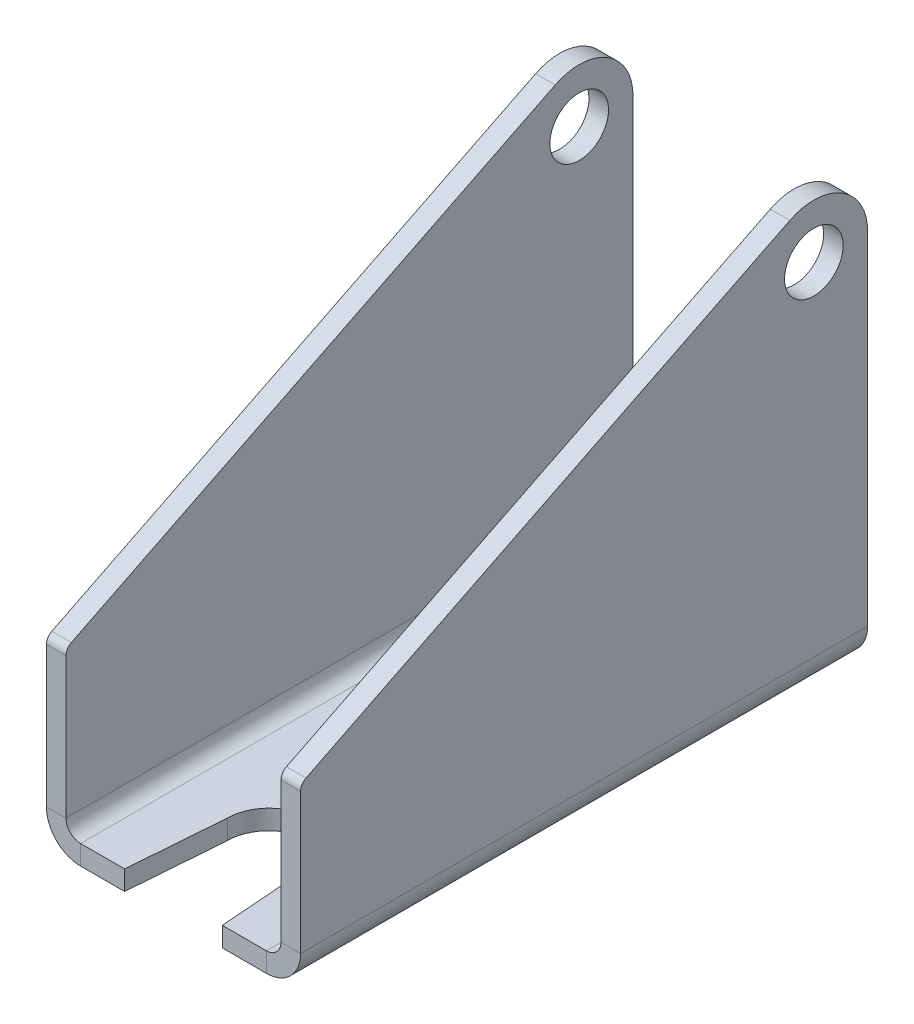
from build123d import *

# Parameters (mm, degrees)
BASE_FLANGIA1_DEPTH            = 2
BORDO_FLANGIA1_STRIP_W         = 11
BORDO_FLANGIA1_STRIP_H         = 2
BORDO_FLANGIA1_STRIP_CUT_DEPTH = 58
BORDO_FLANGIA1_DEPTH           = 58
BORDO_FLANGIA2_STRIP_W         = 11
BORDO_FLANGIA2_STRIP_H         = 2
BORDO_FLANGIA2_STRIP_CUT_DEPTH = 58
BORDO_FLANGIA2_DEPTH           = 58
SCHIZZO11_R                    = 3
TAGLIO_ESTRUSIONE1_DEPTH       = 50
RACCORDO2_R                    = 1
SCHIZZO16_R                    = 4.25
TAGLIO_ESTRUSIONE2_DEPTH       = 10


# Sheet-metal steps are written as plain solids
with BuildPart() as part:
    # Schizzo1 → Base-Flangia1 (new body)
    with BuildSketch(Plane(origin=(0, 0, 0), x_dir=(1, 0, 0), z_dir=(0, 1, 0))):
        Polygon((0, 0), (-6, 0), (-16, 0), (-22, 0), (-22, 58), (0, 58), align=None)
    extrude(amount=-BASE_FLANGIA1_DEPTH)

    # Bordo-Flangia1 strip (across the edge) → Bordo-Flangia1 strip cut (cut)
    with BuildSketch(Plane(origin=(-22, 0, -58), x_dir=(1, 0, 0), z_dir=(0, 0, 1))):
        with Locations((-4, -1)):
            Rectangle(BORDO_FLANGIA1_STRIP_W, BORDO_FLANGIA1_STRIP_H)
    extrude(amount=BORDO_FLANGIA1_STRIP_CUT_DEPTH, mode=Mode.SUBTRACT)

    # Bordo-Flangia1 section (across the edge) → Bordo-Flangia1 (add)
    with BuildSketch(Plane(origin=(-22, 0, -58), x_dir=(1, 0, 0), z_dir=(0, 0, 1))):
        with BuildLine():
            Line((-2, 1.5), (-2, 42))
            Line((-2, 42), (0, 42))
            Line((0, 42), (0, 1.5))
            ThreePointArc((0, 1.5), (0.439339828, 0.439339828), (1.5, 0))
            Line((1.5, 0), (1.5, -2))
            ThreePointArc((1.5, -2), (-0.974873734, -0.974873734), (-2, 1.5))
        make_face()
    extrude(amount=BORDO_FLANGIA1_DEPTH)

    # Bordo-Flangia2 strip (across the edge) → Bordo-Flangia2 strip cut (cut)
    with BuildSketch(Plane(origin=(0, 0, 0), x_dir=(-1, 0, 0), z_dir=(0, 0, -1))):
        with Locations((-4, -1)):
            Rectangle(BORDO_FLANGIA2_STRIP_W, BORDO_FLANGIA2_STRIP_H)
    extrude(amount=BORDO_FLANGIA2_STRIP_CUT_DEPTH, mode=Mode.SUBTRACT)

    # Bordo-Flangia2 section (across the edge) → Bordo-Flangia2 (add)
    with BuildSketch(Plane(origin=(0, 0, 0), x_dir=(-1, 0, 0), z_dir=(0, 0, -1))):
        with BuildLine():
            Line((-2, 1.5), (-2, 42))
            Line((-2, 42), (0, 42))
            Line((0, 42), (0, 1.5))
            ThreePointArc((0, 1.5), (0.439339828, 0.439339828), (1.5, 0))
            Line((1.5, 0), (1.5, -2))
            ThreePointArc((1.5, -2), (-0.974873734, -0.974873734), (-2, 1.5))
        make_face()
    extrude(amount=BORDO_FLANGIA2_DEPTH)

    # Schizzo11 → Taglio-Estrusione1 (cut)
    with BuildSketch(Plane.ZY.offset(24)):
        with BuildLine():
            Line((-58, 42), (-58, 36.5))
            ThreePointArc((-58, 36.5), (-56.389087297, 40.389087297), (-52.5, 42))
            Line((-52.5, 42), (-58, 42))
        make_face()
        with BuildLine():
            Line((-50.048262739, 41.42331031), (0, 16.5))
            Line((0, 16.5), (0, 42))
            Line((0, 42), (-52.5, 42))
            ThreePointArc((-52.5, 42), (-51.240676114, 41.853886752), (-50.048262739, 41.42331031))
        make_face()
        with Locations(Location((-52.5, 36.5, 0), (0, 0, 270))):
            Circle(SCHIZZO11_R)
    extrude(amount=-TAGLIO_ESTRUSIONE1_DEPTH, mode=Mode.SUBTRACT)

    # Raccordo2
    raccordo2_edges = [part.edges().sort_by_distance(p)[0] for p in [
        (1, 16.5, 0),
        (-23, 16.5, 0),
    ]]
    fillet(raccordo2_edges, radius=RACCORDO2_R)

    # Schizzo16 → Taglio-Estrusione2 (cut)
    with BuildSketch(Plane.XZ.offset(2)):
        with Locations(Location((-11, -45.75, 0), (0, 0, 270))):
            Circle(SCHIZZO16_R)
        with BuildLine():
            Line((-15.25, -9.75), (-16, 0))
            Line((-16, 0), (-6, 0))
            Line((-6, 0), (-6.75, -9.75))
            ThreePointArc((-6.75, -9.75), (-11, -14), (-15.25, -9.75))
        make_face()
    extrude(amount=-TAGLIO_ESTRUSIONE2_DEPTH, mode=Mode.SUBTRACT)


solid = part.part
